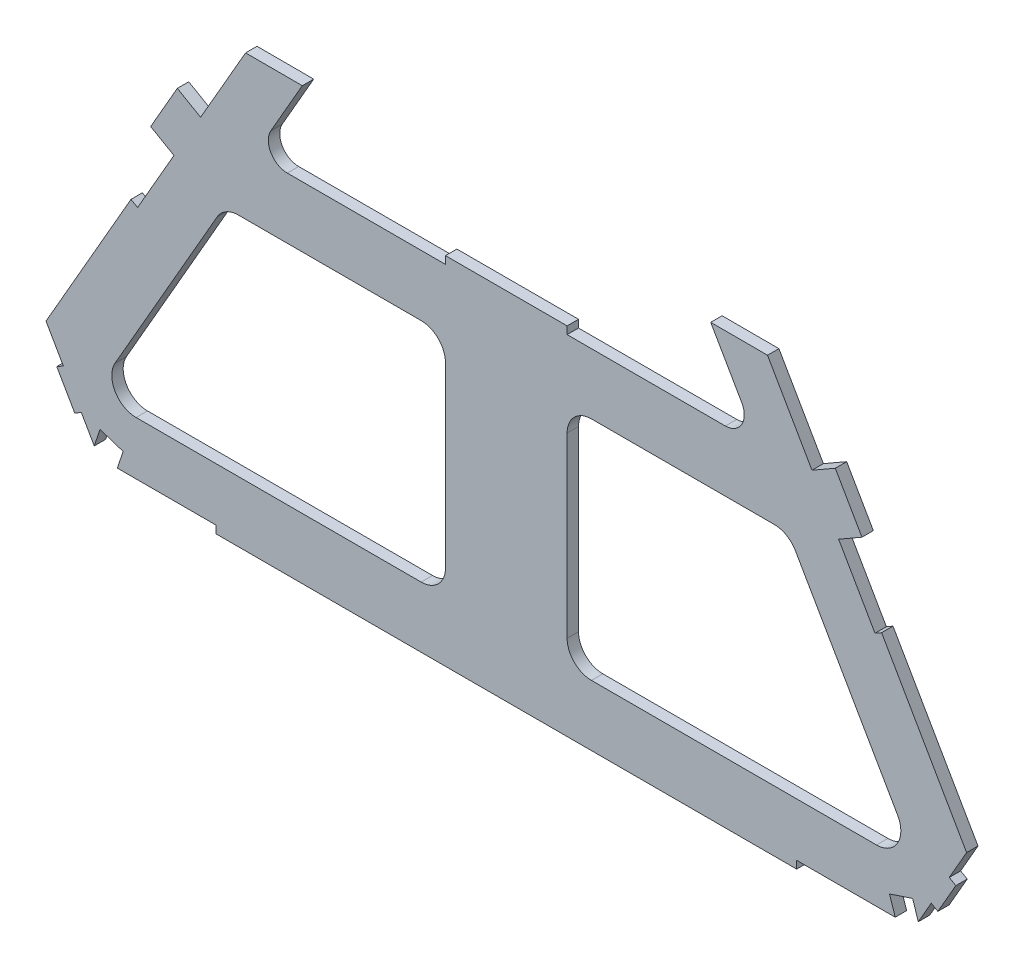
from build123d import *

# Parameters (mm, degrees)
BOSS_EXTRUDE1_DEPTH = 4.7625
CUT_EXTRUDE5_DEPTH  = 591.371112999
SCALE1_SCALE_X      = 0.622
SCALE1_SCALE_Y      = 0.625
SCALE1_SCALE_Z      = 1
CUT_EXTRUDE8_DEPTH  = 422.073439333
FILLET1_R           = 10.16
CUT_EXTRUDE9_DEPTH  = 422.073439333
BOSS_EXTRUDE2_DEPTH = 4.7625
CUT_EXTRUDE10_DEPTH = 422.073439333
CUT_EXTRUDE11_DEPTH = 422.073439333
SKETCH16_W          = 50.8
SKETCH16_H          = 6.35
BOSS_EXTRUDE3_DEPTH = 4.7625
CUT_EXTRUDE12_START = -4.7625
CUT_EXTRUDE12_DEPTH = 4.7625
CUT_EXTRUDE13_DEPTH = 421.232758824


# Read off the part's stored shape, not the designer's step: Cut-Extrude12
with BuildPart() as part:
    # Sketch3 → Boss-Extrude1 (new body)
    with BuildSketch(Plane.XY):
        Polygon((312.000738686, 65.991135768), (166.792028218, 317.5), (-166.792028218, 317.5), (-312.000738686, 65.991135768), (-276.650369343, 4.7625), (276.650369343, 4.7625), align=None)
        Polygon((-166.792028218, 317.5), (166.792028218, 317.5), (60.750369343, 501.169540891), (-60.750369343, 501.169540891), align=None)
    extrude(amount=BOSS_EXTRUDE1_DEPTH)

    # Sketch7 → Cut-Extrude5 (cut, through all)
    with BuildSketch(Plane.XY.offset(4.7625)):
        with BuildLine():
            Line((-147.068010972, 237.363), (147.068010972, 237.363))
            ThreePointArc((147.068010972, 237.363), (158.0665336, 243.713), (158.0665336, 256.413))
            Line((158.0665336, 256.413), (49.751846715, 444.019540891))
            ThreePointArc((49.751846715, 444.019540891), (45.103324087, 448.668063519), (38.753324087, 450.369540891))
            Line((38.753324087, 450.369540891), (-38.753324087, 450.369540891))
            ThreePointArc((-38.753324087, 450.369540891), (-45.103324087, 448.668063519), (-49.751846715, 444.019540891))
            Line((-49.751846715, 444.019540891), (-158.0665336, 256.413))
            ThreePointArc((-158.0665336, 256.413), (-158.0665336, 243.713), (-147.068010972, 237.363))
        make_face()
    extrude(amount=-CUT_EXTRUDE5_DEPTH, mode=Mode.SUBTRACT)


with BuildPart() as part_1:
    # Scale1: scaled about (0, 161.134641619, 2.38125)
    add(part.part.scale((SCALE1_SCALE_X, SCALE1_SCALE_Y, SCALE1_SCALE_Z), about=(0, 161.134641619, 2.38125)))

    # Sketch11 → Cut-Extrude8 (cut, through all)
    with BuildSketch(Plane.XY.offset(4.7625)):
        Polygon((25.4, 183.377365607), (25.4, 88.802053107), (172.163821071, 88.802053107), (117.822833735, 183.377365607), align=None)
        Polygon((-117.822833735, 183.377365607), (-25.4, 183.377365607), (-25.4, 88.802053107), (-172.163821071, 88.802053107), align=None)
    extrude(amount=-CUT_EXTRUDE8_DEPTH, mode=Mode.SUBTRACT)

    # Fillet1
    fillet1_edges = [part_1.edges().sort_by_distance(p)[0] for p in [
        (-172.163821071, 88.802053107, 2.38125),
        (-117.822833735, 183.377365607, 2.38125),
        (-25.4, 183.377365607, 2.38125),
        (-25.4, 88.802053107, 2.38125),
        (117.822833735, 183.377365607, 2.38125),
        (172.163821071, 88.802053107, 2.38125),
        (25.4, 88.802053107, 2.38125),
        (25.4, 183.377365607, 2.38125),
    ]]
    fillet(fillet1_edges, radius=FILLET1_R)

    # Sketch12 → Cut-Extrude9 (cut, through all)
    with BuildSketch(Plane.XY.offset(4.7625)):
        Polygon((141.549539127, 193.067167281), (156.734576332, 166.639056393), (153.981648115, 165.057281684), (138.796610909, 191.485392572), align=None)
        Polygon((101.309190532, 263.101661132), (98.556262314, 261.519886423), (127.660916958, 210.866007222), (130.413845176, 212.447781931), align=None)
        Polygon((-153.981648115, 165.057281684), (-138.796610909, 191.485392572), (-141.549539127, 193.067167281), (-156.734576332, 166.639056393), align=None)
        Polygon((-127.660916958, 210.866007222), (-130.413845176, 212.447781931), (-101.309190532, 263.101661132), (-98.556262314, 261.519886423), align=None)
    extrude(amount=-CUT_EXTRUDE9_DEPTH, mode=Mode.SUBTRACT)

    # Sketch13 → Boss-Extrude2 (add)
    with BuildSketch(Plane.XY.offset(4.7625)):
        Polygon((130.413845176, 212.447781931), (141.549539127, 193.067167281), (148.526307077, 197.075871548), (137.390613126, 216.456486199), align=None)
        Polygon((-148.526307077, 197.075871548), (-137.390613126, 216.456486199), (-130.413845176, 212.447781931), (-141.549539127, 193.067167281), align=None)
    extrude(amount=-BOSS_EXTRUDE2_DEPTH)

    # Sketch14 → Cut-Extrude10 (cut, through all)
    with BuildSketch(Plane.XY.offset(4.7625)):
        Polygon((172.076529731, 63.402053107), (173.900818018, 66.577053107), (121.276529731, 66.577053107), (121.276529731, 63.402053107), align=None)
        Polygon((-121.276529731, 66.577053107), (-121.276529731, 63.402053107), (-172.076529731, 63.402053107), (-173.900818018, 66.577053107), align=None)
    extrude(amount=-CUT_EXTRUDE10_DEPTH, mode=Mode.SUBTRACT)

    # Sketch15 → Cut-Extrude11 (cut, through all)
    with BuildSketch(Plane.XY.offset(4.7625)):
        Polygon((194.064459463, 101.669950462), (192.233568098, 104.85644249), (184.98443241, 92.240012302), (187.737360627, 90.658237593), align=None)
        Polygon((173.900818018, 66.577053107), (180.227916854, 77.588765977), (177.474988636, 79.170540686), (170.239035289, 66.577053107), align=None)
        Polygon((-177.474988636, 79.170540686), (-170.239035289, 66.577053107), (-173.900818018, 66.577053107), (-180.227916854, 77.588765977), align=None)
        Polygon((-187.737360627, 90.658237593), (-184.98443241, 92.240012302), (-192.233568098, 104.85644249), (-194.064459463, 101.669950462), align=None)
    extrude(amount=-CUT_EXTRUDE11_DEPTH, mode=Mode.SUBTRACT)

    # Sketch16 → Boss-Extrude3 (add)
    with BuildSketch(Plane.XY.offset(4.7625)):
        with Locations((0, 208.777365607)):
            Rectangle(SKETCH16_W, SKETCH16_H)
    extrude(amount=-BOSS_EXTRUDE3_DEPTH)

    # Cut-Extrude12 outline → Cut-Extrude12 (cut)
    with BuildSketch(Plane.XY.offset(4.7625).offset(CUT_EXTRUDE12_START)):
        Polygon((-160.03407886, 73.810353985), (-169.67848003, 77.005839249), (-172.075093978, 69.772538371), (-170.239035289, 66.577053107), (-162.430692808, 66.577053107), align=None)
    cut_extrude12 = extrude(amount=CUT_EXTRUDE12_DEPTH, mode=Mode.SUBTRACT)

    # Mirror1: Cut-Extrude12 across plane
    add(cut_extrude12.mirror(Plane(origin=(0, 0, 0), x_dir=(0, 0, 1), z_dir=(1, 0, 0))), mode=Mode.SUBTRACT)

    # Sketch18 → Cut-Extrude13 (cut, through all)
    with BuildSketch(Plane.XY.offset(4.7625)):
        Polygon((-37.786729731, 373.656453664), (37.786729731, 373.656453664), (112.762236491, 243.168725538), (-113.438180507, 243.559444472), align=None)
    extrude(amount=-CUT_EXTRUDE13_DEPTH, mode=Mode.SUBTRACT)


solid = part_1.part
